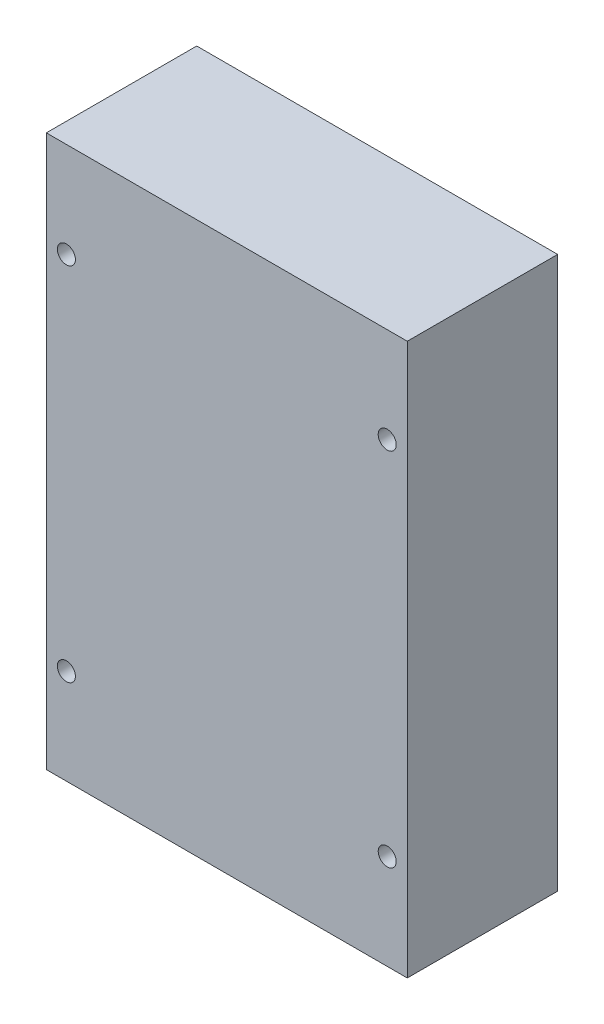
from build123d import *

# Parameters (mm, degrees)
ESQUISSE1_W        = 72
ESQUISSE1_H        = 110
BOSS_EXTRU_1_DEPTH = 30
D_GAGEMENT_M31_D   = 3.6


with BuildPart() as part:
    # Esquisse1 → Boss.-Extru.1 (new body)
    with BuildSketch(Plane.XY):
        with Locations((36, 55)):
            Rectangle(ESQUISSE1_W, ESQUISSE1_H)
    extrude(amount=BOSS_EXTRU_1_DEPTH)

    # Dégagement M31 (through all)
    with Locations(Plane.XY.offset(30)):
        with Locations((4, 91), (68, 91), (4, 19), (68, 19)):
            Hole(D_GAGEMENT_M31_D / 2)


solid = part.part
